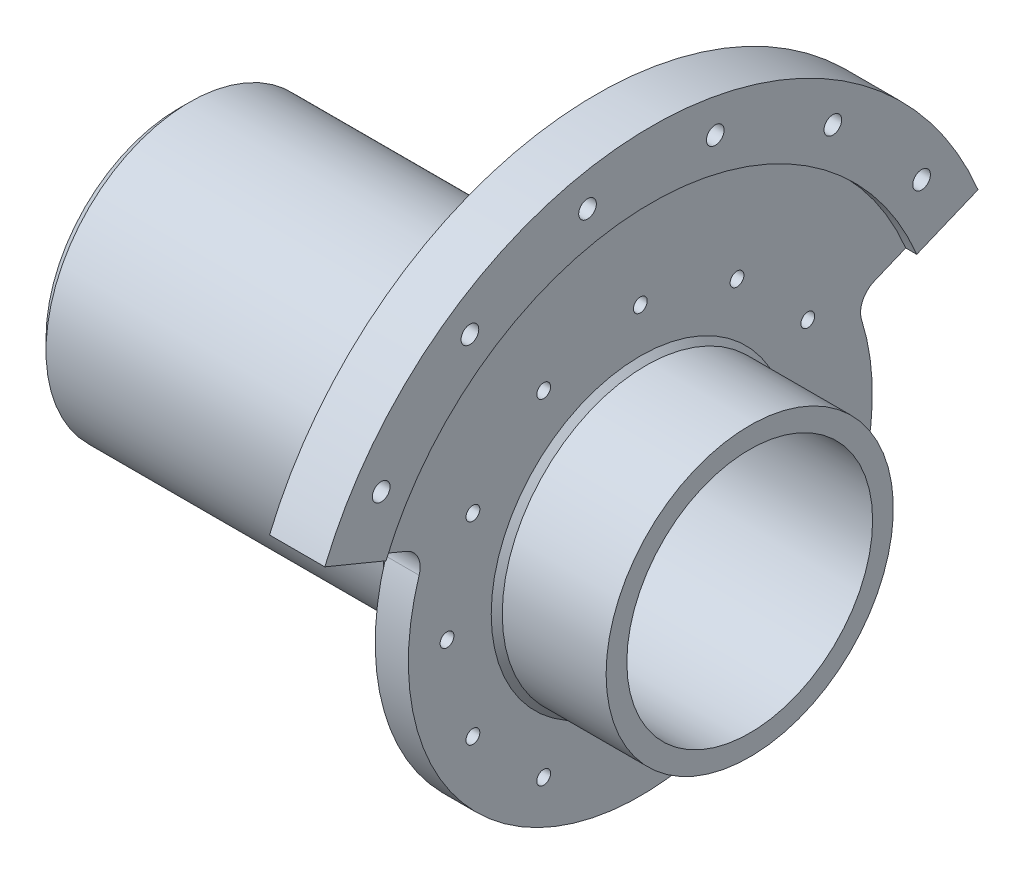
from build123d import *

# Parameters (mm, degrees)
SKETCH1_W                                    = 51.7
SKETCH1_H                                    = 1.875
SKETCH2_W                                    = 3
SKETCH2_H                                    = 3.625
CHAMFER1_SIZE                                = 1
M2_CLEARANCE_HOLE1_D                         = 2.4
M2_CLEARANCE_HOLE1_DEPTH                     = 11.5
CIRPATTERN1_COUNT                            = 6
SKETCH6_W                                    = 3
SKETCH6_H                                    = 19
REVOLVE3_ANGLE                               = 135
SKETCH9_W                                    = 3
SKETCH9_H                                    = 8
CHAMFER2_SIZE                                = 0.5
SKETCH11_W                                   = 5
SKETCH11_H                                   = 6
REVOLVE5_ANGLE                               = 135
CHAMFER4_SIZE                                = 1
TAP_DRILL_FOR_M1_6_TAP1_D                    = 1.25
TAP_DRILL_FOR_M1_6_TAP1_DEPTH                = 11.5
CIRPATTERN2_COUNT                            = 12
FILLET1_R                                    = 2
SKETCH17_W                                   = 2.5
SKETCH17_H                                   = 1.95
ESQUISSE2_W                                  = 1
ESQUISSE2_H                                  = 6
R_VOLUTION4_ANGLE                            = 135
SKETCH13_W                                   = 0.8
SKETCH13_H                                   = 41.8
TROU_POUR_TARAUDAGE_POUR_TROU_TARAUD_2_COUNT = 2
TROU_POUR_TARAUDAGE_POUR_TROU_TARAUD_2_PITCH = 11.563340196
TROU_POUR_TARAUDAGE_POUR_TROU_TARAUD_3_COUNT = 2
TROU_POUR_TARAUDAGE_POUR_TROU_TARAUD_3_PITCH = 11.563340196
TROU_POUR_TARAUDAGE_POUR_TROU_TARAUD_4_COUNT = 2
TROU_POUR_TARAUDAGE_POUR_TROU_TARAUD_4_PITCH = 22.662405452
TROU_POUR_TARAUDAGE_POUR_TROU_TARAUD_5_COUNT = 2
TROU_POUR_TARAUDAGE_POUR_TROU_TARAUD_5_PITCH = 32.851561742
TROU_POUR_TARAUDAGE_POUR_TROU_TARAUD_6_COUNT = 2
TROU_POUR_TARAUDAGE_POUR_TROU_TARAUD_6_PITCH = 41.72170842


with BuildPart() as part:
    # Sketch1 → Revolve1 (revolve)
    with BuildSketch(Plane.XY):
        with Locations((-14.45, 12.0625)):
            Rectangle(SKETCH1_W, SKETCH1_H)
    revolve(axis=Axis((0, 0, 0), (1, 0, 0)))

    # Sketch2 → Revolve2 (revolve)
    with BuildSketch(Plane.XY):
        with Locations((-38.8, 9.3125)):
            Rectangle(SKETCH2_W, SKETCH2_H)
    revolve(axis=Axis((-40.3, 0, 0), (1, 0, 0)))

    # Chamfer1
    chamfer1_edges = [part.edges().sort_by_distance(p)[0] for p in [
        (-40.3, -13, 0),
    ]]
    chamfer(chamfer1_edges, length=CHAMFER1_SIZE)

    # M2 Clearance Hole1
    with Locations(Plane.ZY.offset(40.3)):
        with Locations((0, 9.5)):
            m2_clearance_hole1 = Hole(M2_CLEARANCE_HOLE1_D / 2, depth=M2_CLEARANCE_HOLE1_DEPTH)

    # CirPattern1: M2 Clearance Hole1 ×6 about axis
    cirpattern1_axis = Axis((0, 0, 0), (-1, 0, 0))
    for i in range(1, CIRPATTERN1_COUNT):
        add(m2_clearance_hole1.rotate(cirpattern1_axis, i * 360 / CIRPATTERN1_COUNT), mode=Mode.SUBTRACT)

    # Sketch6 → Revolve3 (revolve, symmetric)
    with BuildSketch(Plane.XY) as revolve3_sk:
        with Locations((0, 22.5)):
            Rectangle(SKETCH6_W, SKETCH6_H)
    revolve(axis=Axis((0, 0, 0), (1, 0, 0)), revolution_arc=REVOLVE3_ANGLE / 2)
    revolve(revolve3_sk.sketch, axis=Axis((0, 0, 0), (-1, 0, 0)), revolution_arc=REVOLVE3_ANGLE / 2)

    # Sketch9 → Revolve4 (revolve)
    with BuildSketch(Plane.XY):
        with Locations((0, 17)):
            Rectangle(SKETCH9_W, SKETCH9_H)
    revolve(axis=Axis((0, 0, 0), (1, 0, 0)))

    # Chamfer2
    chamfer2_edges = [part.edges().sort_by_distance(p)[0] for p in [
        (1.5, -13, 0),
        (-1.5, -13, 0),
    ]]
    chamfer(chamfer2_edges, length=CHAMFER2_SIZE)

    # Sketch11 → Revolve5 (revolve, symmetric)
    with BuildSketch(Plane.XY) as revolve5_sk:
        with Locations((-1, 29)):
            Rectangle(SKETCH11_W, SKETCH11_H)
    revolve(axis=Axis((0, 0, 0), (1, 0, 0)), revolution_arc=REVOLVE5_ANGLE / 2)
    revolve(revolve5_sk.sketch, axis=Axis((0, 0, 0), (-1, 0, 0)), revolution_arc=REVOLVE5_ANGLE / 2)

    # Chamfer4
    chamfer4_edges = [part.edges().sort_by_distance(p)[0] for p in [
        (-3.5, 32, 0),
    ]]
    chamfer(chamfer4_edges, length=CHAMFER4_SIZE)

    # Tap Drill for M1.6 Tap1
    with Locations(Plane.ZY.offset(1.5)):
        with Locations((0, 17.5)):
            tap_drill_for_m1_6_tap1 = Hole(TAP_DRILL_FOR_M1_6_TAP1_D / 2, depth=TAP_DRILL_FOR_M1_6_TAP1_DEPTH)

    # CirPattern2: Tap Drill for M1.6 Tap1 ×12 about axis
    cirpattern2_axis = Axis((0, 0, 0), (-1, 0, 0))
    for i in range(1, CIRPATTERN2_COUNT):
        add(tap_drill_for_m1_6_tap1.rotate(cirpattern2_axis, i * 360 / CIRPATTERN2_COUNT), mode=Mode.SUBTRACT)

    # Fillet1
    fillet1_edges = [part.edges().sort_by_distance(p)[0] for p in [
        (0, 8.03635208, 19.401470183),
        (0, 8.03635208, -19.401470183),
    ]]
    fillet(fillet1_edges, radius=FILLET1_R)

    # Sketch17 → Revolve6 (revolve)
    with BuildSketch(Plane.XY):
        with Locations((-5.55, 13.975)):
            Rectangle(SKETCH17_W, SKETCH17_H)
    revolve(axis=Axis((0, 0, 0), (-1, 0, 0)))

    # Esquisse1 → Enlèvement de matière-Révolution1 (revolve, cut)
    with BuildSketch(Plane(origin=(0, 0, 0), x_dir=(1, 0, 0), z_dir=(0, -0.9238795325112878, 0.3826834323650874))):
        Polygon((-3.5, 31), (-2.5, 32), (-2.5, 26), (-3.5, 26), align=None)
    revolve(axis=Axis((-40.3, 0, 0), (1, 0, 0)), mode=Mode.SUBTRACT)

    # Esquisse2 → Révolution4 (revolve)
    with BuildSketch(Plane(origin=(0, 0, 0), x_dir=(1, 0, 0), z_dir=(0, -0.9238795325112878, 0.3826834323650874))):
        with Locations((2, 29)):
            Rectangle(ESQUISSE2_W, ESQUISSE2_H)
    revolve(axis=Axis((11.4, 0, 0), (-1, 0, 0)), revolution_arc=R_VOLUTION4_ANGLE)

    # Sketch13 → Trou pour taraudage pour trou taraudé M21 (revolve, cut)
    with BuildSketch(Plane(origin=(1.5, 23.89965947, -16.425780871), x_dir=(0, 0, -1), z_dir=(0, 1, 0))):
        with Locations((0.4, 19.9)):
            Rectangle(SKETCH13_W, SKETCH13_H)
    trou_pour_taraudage_pour_trou_taraud_m2 = revolve(axis=Axis((8.85, 23.89965947, -16.425780871), (-1, 0, 0)), mode=Mode.SUBTRACT)

    # Trou pour taraudage pour trou taraud 2: Trou pour taraudage pour trou taraudé M21 ×2
    with Locations(*[Vector(0, -0.7193398003386469, -0.6946583704590019) * (i * TROU_POUR_TARAUDAGE_POUR_TROU_TARAUD_2_PITCH) for i in range(1, TROU_POUR_TARAUDAGE_POUR_TROU_TARAUD_2_COUNT)]):
        add(trou_pour_taraudage_pour_trou_taraud_m2, mode=Mode.SUBTRACT)

    # Trou pour taraudage pour trou taraud 3: Trou pour taraudage pour trou taraudé M21 ×2
    with Locations(*[Vector(0, 0.3907311284892686, 0.9205048534524425) * (i * TROU_POUR_TARAUDAGE_POUR_TROU_TARAUD_3_PITCH) for i in range(1, TROU_POUR_TARAUDAGE_POUR_TROU_TARAUD_3_COUNT)]):
        add(trou_pour_taraudage_pour_trou_taraud_m2, mode=Mode.SUBTRACT)

    # Trou pour taraudage pour trou taraud 4: Trou pour taraudage pour trou taraudé M21 ×2
    with Locations(*[Vector(0, 0.19936793441719058, 0.979924704620831) * (i * TROU_POUR_TARAUDAGE_POUR_TROU_TARAUD_4_PITCH) for i in range(1, TROU_POUR_TARAUDAGE_POUR_TROU_TARAUD_4_COUNT)]):
        add(trou_pour_taraudage_pour_trou_taraud_m2, mode=Mode.SUBTRACT)

    # Trou pour taraudage pour trou taraud 5: Trou pour taraudage pour trou taraudé M21 ×2
    with Locations(*[(0, 0, i * TROU_POUR_TARAUDAGE_POUR_TROU_TARAUD_5_PITCH) for i in range(1, TROU_POUR_TARAUDAGE_POUR_TROU_TARAUD_5_COUNT)]):
        add(trou_pour_taraudage_pour_trou_taraud_m2, mode=Mode.SUBTRACT)

    # Trou pour taraudage pour trou taraud 6: Trou pour taraudage pour trou taraudé M21 ×2
    with Locations(*[Vector(0, -0.19936793441720455, 0.9799247046208281) * (i * TROU_POUR_TARAUDAGE_POUR_TROU_TARAUD_6_PITCH) for i in range(1, TROU_POUR_TARAUDAGE_POUR_TROU_TARAUD_6_COUNT)]):
        add(trou_pour_taraudage_pour_trou_taraud_m2, mode=Mode.SUBTRACT)


solid = part.part
